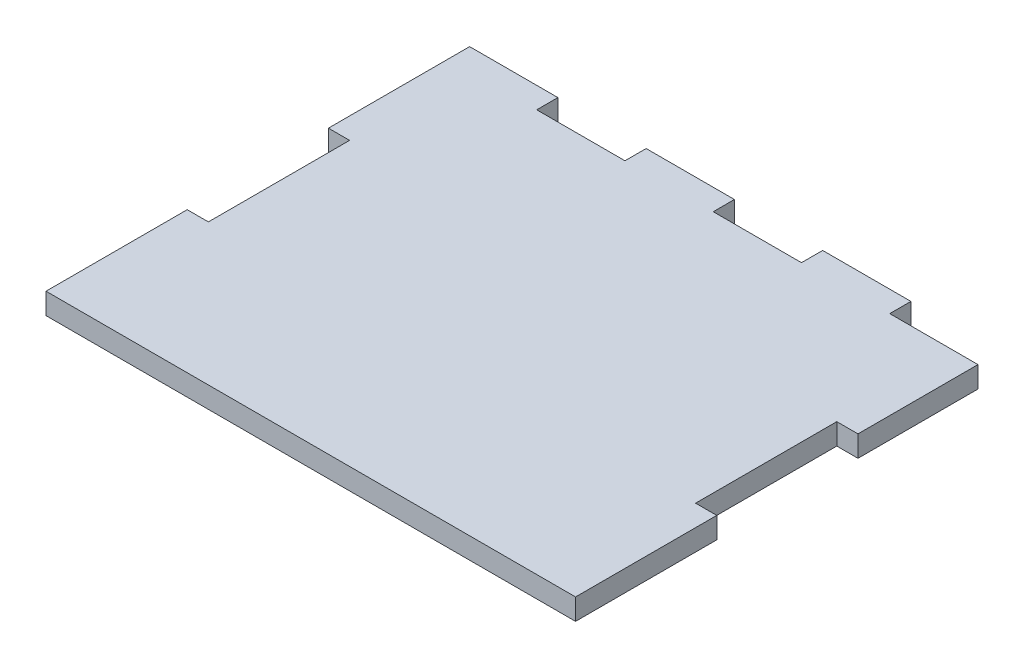
from build123d import *

# Parameters (mm, degrees)
SKETCH1_W           = 150
SKETCH1_H           = 120
BOSS_EXTRUDE1_DEPTH = 6
SKETCH2_W           = 25
SKETCH2_H           = 6
SKETCH2_W_2         = 6
SKETCH2_H_2         = 40
CUT_EXTRUDE1_DEPTH  = 6


with BuildPart() as part:
    # Sketch1 → Boss-Extrude1 (new body)
    with BuildSketch(Plane(origin=(0, 0, 0), x_dir=(1, 0, 0), z_dir=(0, 1, 0))):
        with Locations((75, 140)):
            Rectangle(SKETCH1_W, SKETCH1_H)
    extrude(amount=BOSS_EXTRUDE1_DEPTH)

    # Sketch2 → Cut-Extrude1 (cut)
    with BuildSketch(Plane(origin=(0, 6, 0), x_dir=(1, 0, 0), z_dir=(0, 1, 0))):
        with Locations((37.5, 197)):
            Rectangle(SKETCH2_W, SKETCH2_H)
        with Locations((87.5, 197)):
            Rectangle(SKETCH2_W, SKETCH2_H)
        with Locations((137.5, 197)):
            Rectangle(SKETCH2_W, SKETCH2_H)
        with Locations((3, 140)):
            Rectangle(SKETCH2_W_2, SKETCH2_H_2)
        with Locations((147, 140)):
            Rectangle(SKETCH2_W_2, SKETCH2_H_2)
    extrude(amount=-CUT_EXTRUDE1_DEPTH, mode=Mode.SUBTRACT)


solid = part.part
